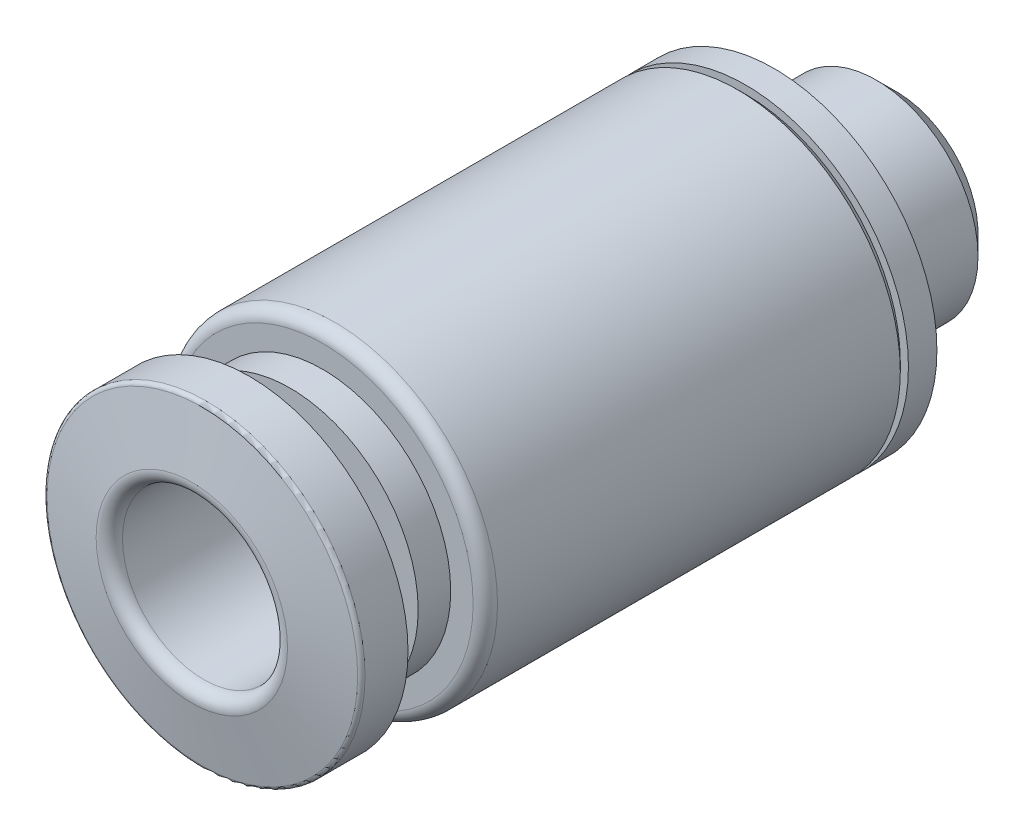
from build123d import *

# Parameters (mm, degrees)
CUT_EXTRUDE1_2_OUTLINE_R = 2
CUT_EXTRUDE1_2_DEPTH     = 9.64
CUT_EXTRUDE1_3_DEPTH     = 0.141623609
CHAMFER1_SIZE            = 0.4905
FILLET1_R                = 0.1
FILLET2_R                = 0.3


with BuildPart() as part:
    # Cut-Extrude1: read off the stored shape, not the designer's step
    # Cut-Extrude1 outline → Cut-Extrude1 (revolve)
    with BuildSketch(Plane.XZ):
        Polygon((3.8, 3.7), (4, 3.9), (4, 14.1), (3.15, 14.1), (3.15, 14.9), (2.45, 14.9), (2.45, 15.9), (3.9, 15.9), (3.9, 17.040270357), (2, 17.375291621), (2, 0), (2.5, 0), (2.5, 3), (4, 3), (4, 3.7), align=None)
    revolve(axis=Axis((0, 0, 0), (0, 0, 1)))

    # Cut-Extrude1 2 outline → Cut-Extrude1 2 (add)
    with BuildSketch(Plane.XY):
        Circle(CUT_EXTRUDE1_2_OUTLINE_R)
        Polygon((1, -0.577350269), (0, -1.154700538), (-1, -0.577350269), (-1, 0.577350269), (0, 1.154700538), (1, 0.577350269), align=None, mode=Mode.SUBTRACT)
    extrude(amount=CUT_EXTRUDE1_2_DEPTH)

    # Cut-Extrude1 3 outline → Cut-Extrude1 3 (add)
    with BuildSketch(Plane.XY):
        Polygon((-1, -0.577350269), (0, -1.154700538), (1, -0.577350269), (1, 0.57735027), (0, 1.154700538), (-1, 0.577350269), align=None)
    extrude(amount=CUT_EXTRUDE1_3_DEPTH)

    # Cut-Extrude1 4 outline → Cut-Extrude1 4 (revolve)
    with BuildSketch(Plane.XZ):
        Polygon((0.999972461, 0.230956007), (0, 0.230956007), (0, 0.141623609), (1.154700539, 0.141623609), align=None)
    revolve(axis=Axis((0, 0, 0), (0, 0, 1)))

    # Sketch2 → Cut-Revolve1 (revolve, cut)
    with BuildSketch(Plane(origin=(0, 0, 0), x_dir=(1, 0, 0), z_dir=(0, 1, 0)), mode=Mode.PRIVATE) as cut_revolve1_sk:
        Polygon((1.4, 0), (0, 0), (0, -0.230956007), (0.999972461, -0.230956007), align=None)
    revolve(cut_revolve1_sk.sketch.rotate(Axis((0, 0, 0), (0, 0, 1)), 180), axis=Axis((0, 0, 0), (0, 0, 1)), mode=Mode.SUBTRACT)

    # Chamfer1
    chamfer1_edges = [part.edges().sort_by_distance(p)[0] for p in [
        (-2.5, 0, 0),
    ]]
    chamfer(chamfer1_edges, length=CHAMFER1_SIZE)

    # Fillet1
    fillet1_edges = [part.edges().sort_by_distance(p)[0] for p in [
        (-3.9, 0, 17.040270357),
    ]]
    fillet(fillet1_edges, radius=FILLET1_R)

    # Fillet2
    fillet2_edges = [part.edges().sort_by_distance(p)[0] for p in [
        (-2, 0, 17.375291621),
        (-4, 0, 14.1),
    ]]
    fillet(fillet2_edges, radius=FILLET2_R)


solid = part.part
